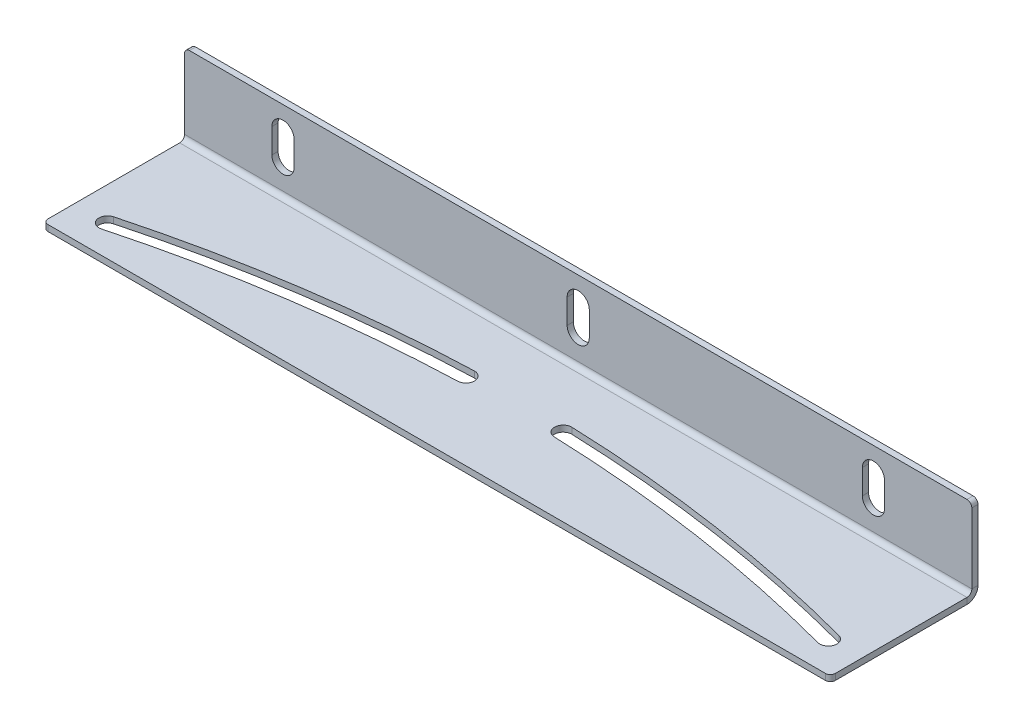
from build123d import *

# Parameters (mm, degrees)
SM_BASE_FLANGE_1_DEPTH = 160
CUT_EXTRUDE_2_DEPTH    = 174.583553368
CUT_EXTRUDE_3_REACH    = 175.943
OTHER_1_DEPTH          = 2.5
OTHER_1_2_DEPTH        = 2.5


# Read off the part's stored shape, not the designer's step: 断开-边角1
# Sheet-metal steps are written as plain solids
with BuildPart() as part:
    # Sketch 1 → 基体-法兰1 (new, symmetric)
    with BuildSketch(Plane(origin=(0, 0, 0), x_dir=(0, 0, -1), z_dir=(1, 0, 0))):
        with BuildLine():
            Line((-60, 0), (-4.5, 0))
            ThreePointArc((-4.5, 0), (-1.318019485, 1.318019485), (0, 4.5))
            Line((0, 4.5), (0, 35))
            Line((0, 35), (-2.5, 35))
            Line((-2.5, 35), (-2.5, 4.5))
            ThreePointArc((-2.5, 4.5), (-3.085786438, 3.085786438), (-4.5, 2.5))
            Line((-4.5, 2.5), (-60, 2.5))
            Line((-60, 2.5), (-60, 0))
        make_face()
    extrude(amount=SM_BASE_FLANGE_1_DEPTH, both=True)

    # 草图5 → 切除-拉伸2 (cut, through all)
    with BuildSketch(Plane.XY.offset(2.5)):
        with BuildLine():
            Line((-115.5, 25), (-115.5, 15))
            ThreePointArc((-115.5, 15), (-120, 10.5), (-124.5, 15))
            Line((-124.5, 15), (-124.5, 25))
            ThreePointArc((-124.5, 25), (-120, 29.5), (-115.5, 25))
        make_face()
        with BuildLine():
            Line((115.5, 25), (115.5, 15))
            ThreePointArc((115.5, 15), (120, 10.5), (124.5, 15))
            Line((124.5, 15), (124.5, 25))
            ThreePointArc((124.5, 25), (120, 29.5), (115.5, 25))
        make_face()
        with BuildLine():
            Line((4.5, 25), (4.5, 15))
            ThreePointArc((4.5, 15), (0, 10.5), (-4.5, 15))
            Line((-4.5, 15), (-4.5, 25))
            ThreePointArc((-4.5, 25), (0, 29.5), (4.5, 25))
        make_face()
    extrude(amount=-CUT_EXTRUDE_2_DEPTH, mode=Mode.SUBTRACT)

    # 草图6 → 切除-拉伸3 (cut, up to next)
    with BuildSketch(Plane(origin=(0, 2.5, 0), x_dir=(1, 0, 0), z_dir=(0, 1, 0)), mode=Mode.PRIVATE) as cut_extrude_3_sk1:
        with BuildLine():
            ThreePointArc((-19.874276789, -24.875176049), (-84.173281176, -30.783424559), (-147.390129564, -43.932547934))
            ThreePointArc((-147.390129564, -43.932547934), (-149.865003298, -48.219154984), (-145.578396248, -50.694028718))
            ThreePointArc((-145.578396248, -50.694028718), (-83.138615298, -37.706535603), (-19.629980312, -31.870911838))
            ThreePointArc((-19.629980312, -31.870911838), (-16.254260656, -28.250895705), (-19.874276789, -24.875176049))
        make_face()
    cut_extrude_3_tool1 = extrude(cut_extrude_3_sk1.sketch, amount=-CUT_EXTRUDE_3_REACH, mode=Mode.PRIVATE) & part.part
    # 草图6 → 切除-拉伸3 (cut, up to next)
    with BuildSketch(Plane(origin=(0, 2.5, 0), x_dir=(1, 0, 0), z_dir=(0, 1, 0)), mode=Mode.PRIVATE) as cut_extrude_3_sk2:
        with BuildLine():
            ThreePointArc((19.874276789, -24.875176049), (84.173281176, -30.783424559), (147.390129564, -43.932547934))
            ThreePointArc((147.390129564, -43.932547934), (149.865003298, -48.219154984), (145.578396248, -50.694028718))
            ThreePointArc((145.578396248, -50.694028718), (83.138615298, -37.706535603), (19.629980312, -31.870911838))
            ThreePointArc((19.629980312, -31.870911838), (16.254260656, -28.250895705), (19.874276789, -24.875176049))
        make_face()
    cut_extrude_3_tool2 = extrude(cut_extrude_3_sk2.sketch, amount=-CUT_EXTRUDE_3_REACH, mode=Mode.PRIVATE) & part.part
    add(cut_extrude_3_tool1.solids().sort_by_distance((-83.461905, 2.5, 35.543351))[0], mode=Mode.SUBTRACT)
    add(cut_extrude_3_tool2.solids().sort_by_distance((83.461905, 2.5, 35.543351))[0], mode=Mode.SUBTRACT)

    # Other 1 outline → Other 1 (cut)
    with BuildSketch(Plane(origin=(0, 0, 0), x_dir=(1, 0, 0), z_dir=(0, 1, 0))):
        with BuildLine():
            Line((-160, -60), (-158, -60))
            ThreePointArc((-158, -60), (-159.414213562, -59.414213562), (-160, -58))
            Line((-160, -58), (-160, -60))
        make_face()
        with BuildLine():
            ThreePointArc((160, -58), (159.414213562, -59.414213562), (158, -60))
            Line((158, -60), (160, -60))
            Line((160, -60), (160, -58))
        make_face()
    extrude(amount=OTHER_1_DEPTH, mode=Mode.SUBTRACT)

    # Other 1 2 outline → Other 1 2 (cut)
    with BuildSketch(Plane.XY):
        with BuildLine():
            Line((160, 35), (158, 35))
            ThreePointArc((158, 35), (159.414213562, 34.414213562), (160, 33))
            Line((160, 33), (160, 35))
        make_face()
        with BuildLine():
            ThreePointArc((-160, 33), (-159.414213562, 34.414213562), (-158, 35))
            Line((-158, 35), (-160, 35))
            Line((-160, 35), (-160, 33))
        make_face()
    extrude(amount=OTHER_1_2_DEPTH, mode=Mode.SUBTRACT)


solid = part.part
